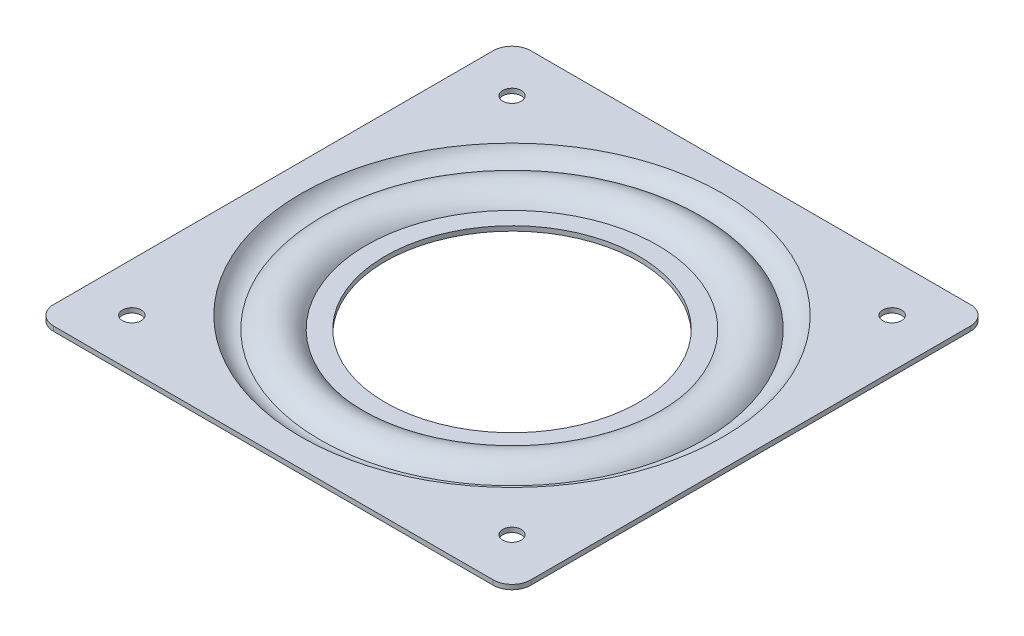
from build123d import *

# Parameters (mm, degrees)
SKETCH_2_R      = 1.985
SKETCH_2_R_2    = 44.910539349
EXTRUDE_1_DEPTH = 1


with BuildPart() as part:
    # 草图1 → 旋转1 (revolve)
    with BuildSketch(Plane.XY):
        with BuildLine():
            ThreePointArc((-31, -2.569785971), (-33.146193621, -0.681105182), (-35.922766673, 0))
            ThreePointArc((-35.922766673, 0), (-36.36897393, -0.016614747), (-36.812709979, -0.066366972))
            ThreePointArc((-36.812709979, -0.066366972), (-39.087205959, -0.902321705), (-40.845533346, -2.569785971))
            ThreePointArc((-40.845533346, -2.569785971), (-43.250116145, -1.873465974), (-44.910539349, 0))
            Line((-44.910539349, 0), (-45.813874016, -0.428936451))
            ThreePointArc((-45.813874016, -0.428936451), (-43.539426354, -2.86488143), (-40.275857757, -3.540203663))
            ThreePointArc((-40.275857757, -3.540203663), (-35.905809817, -1.000028754), (-31.553091654, -3.569785971))
            Line((-31.553091654, -3.569785971), (-27, -3.569785971))
            Line((-27, -3.569785971), (-27, -2.569785971))
            Line((-27, -2.569785971), (-31, -2.569785971))
        make_face()
    revolve(axis=Axis((0, 6.917160425, 0), (0, -1, 0)))

    # 草图2 → 凸台-拉伸1 (add)
    with BuildSketch(Plane(origin=(0, 0, 0), x_dir=(1, 0, 0), z_dir=(0, 1, 0))):
        with BuildLine():
            Line((46.8, 50.8), (-46.8, 50.8))
            ThreePointArc((-46.8, 50.8), (-49.628427125, 49.628427125), (-50.8, 46.8))
            Line((-50.8, 46.8), (-50.8, -46.8))
            ThreePointArc((-50.8, -46.8), (-49.628427125, -49.628427125), (-46.8, -50.8))
            Line((-46.8, -50.8), (46.8, -50.8))
            ThreePointArc((46.8, -50.8), (49.628427125, -49.628427125), (50.8, -46.8))
            Line((50.8, -46.8), (50.8, 46.8))
            ThreePointArc((50.8, 46.8), (49.628427125, 49.628427125), (46.8, 50.8))
        make_face()
        with Locations((-40.48, -40.48)):
            Circle(SKETCH_2_R, mode=Mode.SUBTRACT)
        with Locations((40.48, -40.48)):
            Circle(SKETCH_2_R, mode=Mode.SUBTRACT)
        Circle(SKETCH_2_R_2, mode=Mode.SUBTRACT)
        with Locations((-40.48, 40.48)):
            Circle(SKETCH_2_R, mode=Mode.SUBTRACT)
        with Locations((40.48, 40.48)):
            Circle(SKETCH_2_R, mode=Mode.SUBTRACT)
    extrude(amount=-EXTRUDE_1_DEPTH)


solid = part.part
